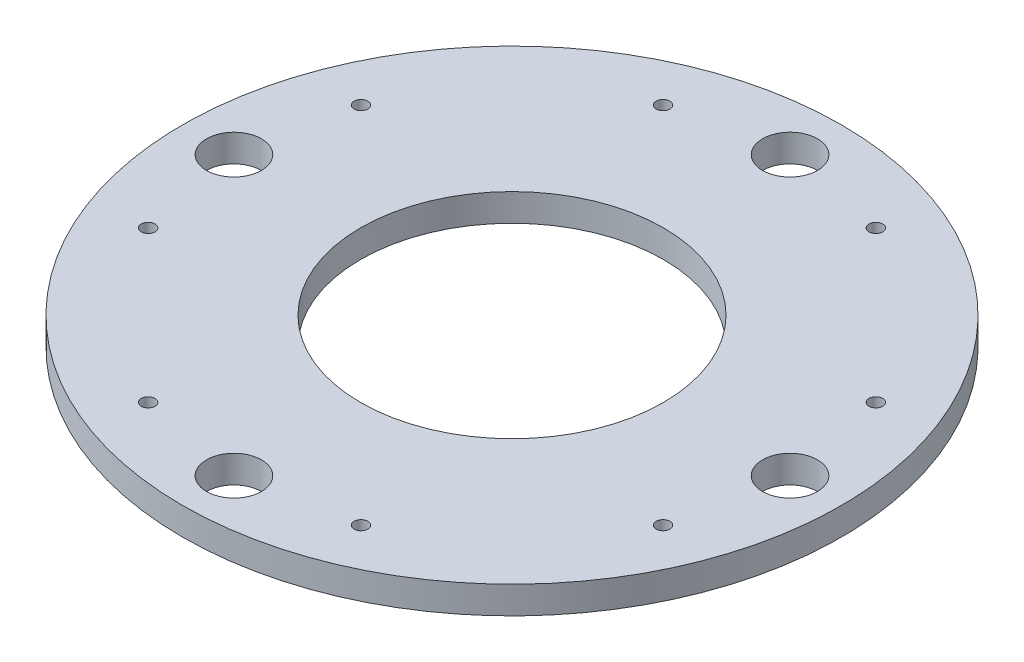
from build123d import *

# Parameters (mm, degrees)
SKETCH1_R           = 76.2
BOSS_EXTRUDE1_DEPTH = 6.35
SKETCH2_R           = 35
CUT_EXTRUDE1_DEPTH  = 6.35
SKETCH3_R           = 6.35
CUT_EXTRUDE2_DEPTH  = 10
SKETCH7_R           = 1.5875
CUT_EXTRUDE4_DEPTH  = 10
SKETCH8_R           = 6.35
CUT_EXTRUDE5_DEPTH  = 10


with BuildPart() as part:
    # Sketch1 → Boss-Extrude1 (new body)
    with BuildSketch(Plane(origin=(0, 0, 0), x_dir=(1, 0, 0), z_dir=(0, 1, 0))):
        Circle(SKETCH1_R)
    extrude(amount=BOSS_EXTRUDE1_DEPTH)

    # Sketch2 → Cut-Extrude1 (cut)
    with BuildSketch(Plane(origin=(0, 6.35, 0), x_dir=(1, 0, 0), z_dir=(0, 1, 0))):
        Circle(SKETCH2_R)
    extrude(amount=-CUT_EXTRUDE1_DEPTH, mode=Mode.SUBTRACT)

    # Sketch3 → Cut-Extrude2 (cut)
    with BuildSketch(Plane(origin=(0, 6.35, 0), x_dir=(1, 0, 0), z_dir=(0, 1, 0))):
        with Locations((-64.2875, 0)):
            Circle(SKETCH3_R)
        with Locations((64.2875, 0)):
            Circle(SKETCH3_R)
    extrude(amount=-CUT_EXTRUDE2_DEPTH, mode=Mode.SUBTRACT)

    # Sketch7 → Cut-Extrude4 (cut)
    with BuildSketch(Plane(origin=(0, 6.35, 0), x_dir=(1, 0, 0), z_dir=(0, 1, 0))):
        with Locations((-24.5999, 59.5249)):
            Circle(SKETCH7_R)
        with Locations((24.5999, 59.5249)):
            Circle(SKETCH7_R)
        with Locations((24.5999, -59.5249)):
            Circle(SKETCH7_R)
        with Locations((-24.5999, -59.5249)):
            Circle(SKETCH7_R)
        with Locations((-59.5249, 24.5999)):
            Circle(SKETCH7_R)
        with Locations((-59.5249, -24.5999)):
            Circle(SKETCH7_R)
        with Locations((59.5249, 24.5999)):
            Circle(SKETCH7_R)
        with Locations((59.5249, -24.5999)):
            Circle(SKETCH7_R)
    extrude(amount=-CUT_EXTRUDE4_DEPTH, mode=Mode.SUBTRACT)

    # Sketch8 → Cut-Extrude5 (cut)
    with BuildSketch(Plane(origin=(0, 6.35, 0), x_dir=(1, 0, 0), z_dir=(0, 1, 0))):
        with Locations((-64.2875, 0)):
            Circle(SKETCH8_R)
        with Locations((64.2875, 0)):
            Circle(SKETCH8_R)
        with Locations((0, -64.2875)):
            Circle(SKETCH8_R)
        with Locations((0, 64.2875)):
            Circle(SKETCH8_R)
    extrude(amount=-CUT_EXTRUDE5_DEPTH, mode=Mode.SUBTRACT)


solid = part.part
